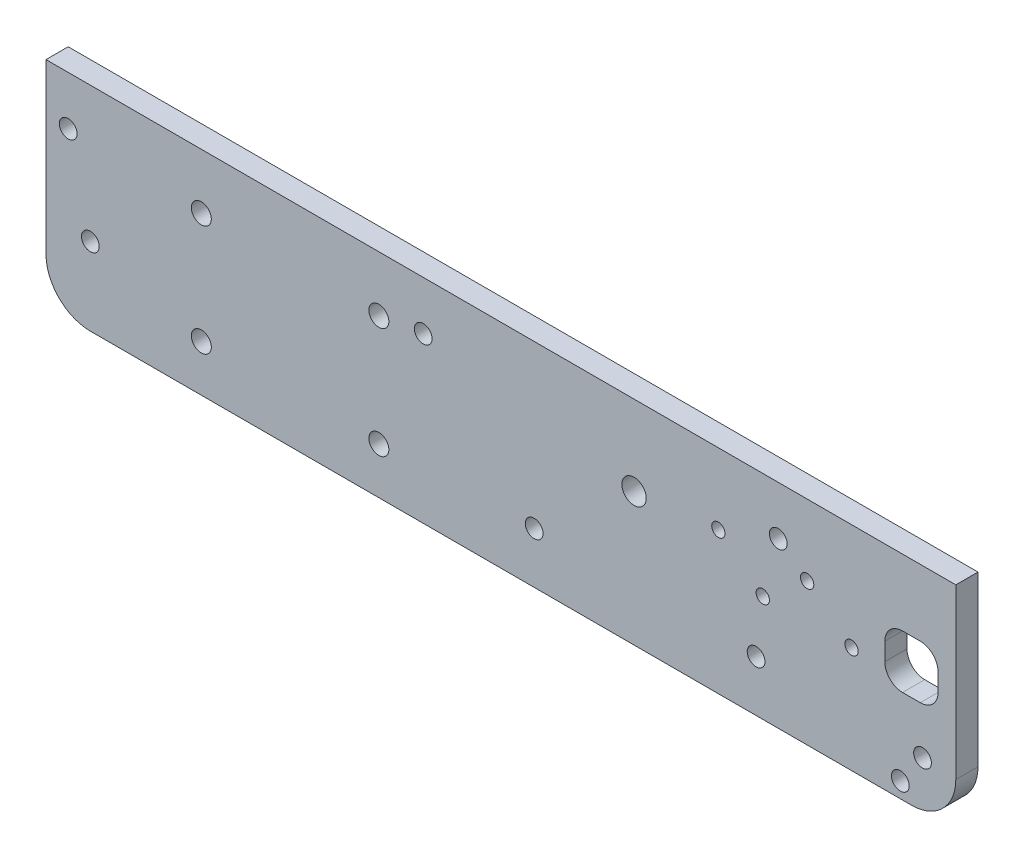
from build123d import *

# Parameters (mm, degrees)
SKETCH_1_R              = 2
EXTRUDE_1_DEPTH         = 5
SKETCH_2_R              = 2.75
SKETCH_2_R_2            = 2
SKETCH_2_R_3            = 2.25
CUT_EXTRUDE_2_DEPTH     = 6
CUT_EXTRUDE_3_OUTLINE_R = 1.5
CUT_EXTRUDE_3_DEPTH     = 5


# Read off the part's stored shape, not the designer's step: 切除-拉伸3
with BuildPart() as part:
    # 草图1 → 凸台-拉伸1 (new body)
    with BuildSketch(Plane.XY):
        with BuildLine():
            Line((-85, 0), (120, 0))
            Line((120, 0), (120, -38))
            ThreePointArc((120, -38), (117.071067812, -45.071067812), (110, -48))
            Line((110, -48), (-75, -48))
            ThreePointArc((-75, -48), (-82.071067812, -45.071067812), (-85, -38))
            Line((-85, -38), (-85, 0))
        make_face()
        with Locations((-80, -11)):
            Circle(SKETCH_1_R, mode=Mode.SUBTRACT)
        with Locations((0, -11)):
            Circle(SKETCH_1_R, mode=Mode.SUBTRACT)
        with Locations((80, -11)):
            Circle(SKETCH_1_R, mode=Mode.SUBTRACT)
        with Locations((75, -36.5)):
            Circle(SKETCH_1_R, mode=Mode.SUBTRACT)
        with Locations(Location((-75, -30.5, 0), (0, 0, 180))):
            Circle(SKETCH_1_R, mode=Mode.SUBTRACT)
        with Locations((25, -36.5)):
            Circle(SKETCH_1_R, mode=Mode.SUBTRACT)
    extrude(amount=EXTRUDE_1_DEPTH)

    # 草图2 → 切除-拉伸2 (cut)
    with BuildSketch(Plane.XY):
        with Locations(Location((47.5, -18, 0), (0, 0, 180))):
            Circle(SKETCH_2_R)
        with Locations(Location((112.5, -37.5, 0), (0, 0, 180))):
            Circle(SKETCH_2_R_2)
        with Locations(Location((107.5, -44.5, 0), (0, 0, 180))):
            Circle(SKETCH_2_R_2)
        with BuildLine():
            ThreePointArc((104, -23), (105.171572875, -25.828427125), (108, -27))
            Line((108, -27), (112, -27))
            ThreePointArc((112, -27), (114.828427125, -25.828427125), (116, -23))
            Line((116, -23), (116, -19))
            ThreePointArc((116, -19), (114.828427125, -16.171572875), (112, -15))
            Line((112, -15), (108, -15))
            ThreePointArc((108, -15), (105.171572875, -16.171572875), (104, -19))
            Line((104, -19), (104, -23))
        make_face()
        with Locations(Location((-50, -12.5, 0), (0, 0, 180))):
            Circle(SKETCH_2_R_3)
        with Locations(Location((-10, -12.5, 0), (0, 0, 180))):
            Circle(SKETCH_2_R_3)
        with Locations(Location((-50, -37.5, 0), (0, 0, 180))):
            Circle(SKETCH_2_R_3)
        with Locations(Location((-10, -37.5, 0), (0, 0, 180))):
            Circle(SKETCH_2_R_3)
    extrude(amount=CUT_EXTRUDE_2_DEPTH, mode=Mode.SUBTRACT)

    # 切除-拉伸3 outline → 切除-拉伸3 (cut)
    with BuildSketch(Plane.XY):
        with Locations((96.5, -24)):
            Circle(CUT_EXTRUDE_3_OUTLINE_R)
        with Locations((86.5, -16)):
            Circle(CUT_EXTRUDE_3_OUTLINE_R)
        with Locations((76.5, -24)):
            Circle(CUT_EXTRUDE_3_OUTLINE_R)
        with Locations((66.5, -16)):
            Circle(CUT_EXTRUDE_3_OUTLINE_R)
    extrude(amount=CUT_EXTRUDE_3_DEPTH, mode=Mode.SUBTRACT)


solid = part.part
